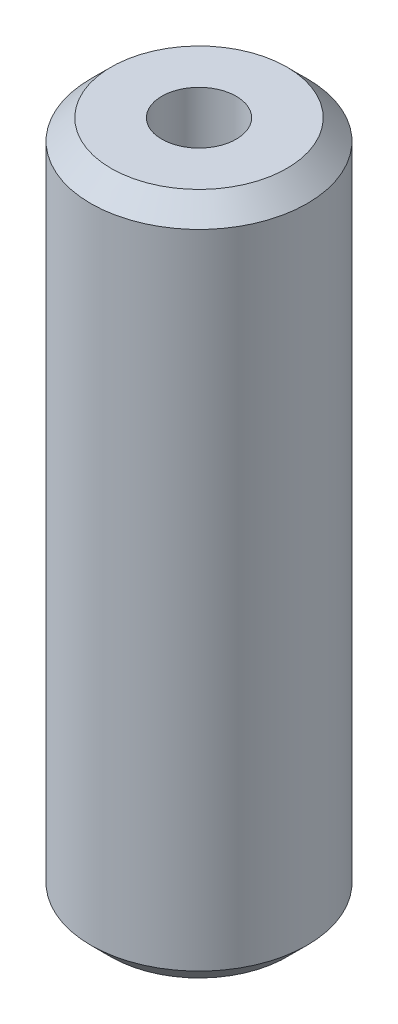
from build123d import *

# Parameters (mm, degrees)
SKETCH1_R           = 15
BOSS_EXTRUDE1_DEPTH = 94.70576974
SKETCH2_R           = 5.164567952
CUT_EXTRUDE1_DEPTH  = 98.052474579
CHAMFER1_SIZE       = 2.815133108


with BuildPart() as part:
    # Sketch1 → Boss-Extrude1 (new body)
    with BuildSketch(Plane(origin=(0, 0, 0), x_dir=(1, 0, 0), z_dir=(0, 1, 0))):
        Circle(SKETCH1_R)
    extrude(amount=BOSS_EXTRUDE1_DEPTH)

    # Sketch2 → Cut-Extrude1 (cut, through all)
    with BuildSketch(Plane(origin=(0, 0, 0), x_dir=(1, 0, 0), z_dir=(0, 1, 0))):
        Circle(SKETCH2_R)
    extrude(amount=CUT_EXTRUDE1_DEPTH, mode=Mode.SUBTRACT)

    # Chamfer1
    chamfer1_edges = [part.edges().sort_by_distance(p)[0] for p in [
        (-15, 94.70576974, 0),
        (-15, 0, 0),
    ]]
    chamfer(chamfer1_edges, length=CHAMFER1_SIZE)


solid = part.part
